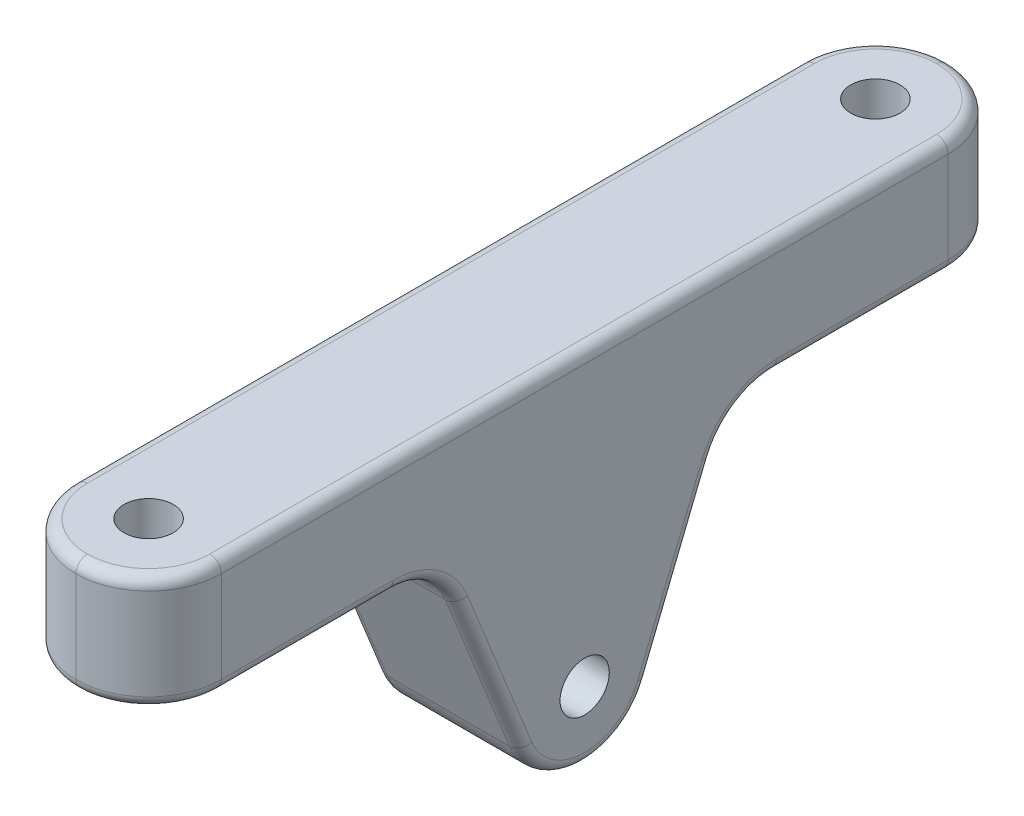
from build123d import *

# Parameters (mm, degrees)
SKETCH1_R           = 2.15
BOSS_EXTRUDE1_DEPTH = 12.7
FILLET1_R           = 6
FILLET2_R           = 6.35
CUT_EXTRUDE1_REACH  = 52.979
SKETCH2_R           = 2.15
CUT_EXTRUDE2_DEPTH  = 4
FILLET3_R           = 1


with BuildPart() as part:
    # Sketch1 → Boss-Extrude1 (new body)
    with BuildSketch(Plane(origin=(0, 0, 0), x_dir=(0, 0, -1), z_dir=(1, 0, 0))):
        Polygon((-38.1, 25.4), (38.1, 25.4), (38.1, 15.4), (12.7, 15.4), (0, -16.003709137), (-12.7, 15.4), (-38.1, 15.4), align=None)
        Circle(SKETCH1_R, mode=Mode.SUBTRACT)
    extrude(amount=BOSS_EXTRUDE1_DEPTH)

    # Fillet1
    fillet1_edges = [part.edges().sort_by_distance(p)[0] for p in [
        (6.35, 15.4, -12.7),
        (6.35, -16.003709137, 0),
        (6.35, 15.4, 12.7),
    ]]
    fillet(fillet1_edges, radius=FILLET1_R)

    # Fillet2
    fillet2_edges = [part.edges().sort_by_distance(p)[0] for p in [
        (0, 20.4, -38.1),
        (12.7, 20.4, -38.1),
        (0, 20.4, 38.1),
        (12.7, 20.4, 38.1),
    ]]
    fillet(fillet2_edges, radius=FILLET2_R - 0.0001)  # a hair under: the kernel refuses the full size

    # Sketch2 → Cut-Extrude1 (cut, up to next)
    with BuildSketch(Plane(origin=(0, 25.4, 0), x_dir=(1, 0, 0), z_dir=(0, 1, 0)), mode=Mode.PRIVATE) as cut_extrude1_sk1:
        with Locations(Location((6.35, -31.75, 0), (0, 0, 270))):
            Circle(SKETCH2_R)
    cut_extrude1_tool1 = extrude(cut_extrude1_sk1.sketch, amount=-CUT_EXTRUDE1_REACH, mode=Mode.PRIVATE) & part.part
    # Sketch2 → Cut-Extrude1 (cut, up to next)
    with BuildSketch(Plane(origin=(0, 25.4, 0), x_dir=(1, 0, 0), z_dir=(0, 1, 0)), mode=Mode.PRIVATE) as cut_extrude1_sk2:
        with Locations(Location((6.35, 31.75, 0), (0, 0, 270))):
            Circle(SKETCH2_R)
    cut_extrude1_tool2 = extrude(cut_extrude1_sk2.sketch, amount=-CUT_EXTRUDE1_REACH, mode=Mode.PRIVATE) & part.part
    add(cut_extrude1_tool1.solids().sort_by_distance((6.35, 25.4, 31.75))[0], mode=Mode.SUBTRACT)
    add(cut_extrude1_tool2.solids().sort_by_distance((6.35, 25.4, -31.75))[0], mode=Mode.SUBTRACT)

    # Sketch3 → Cut-Extrude2 (cut)
    with BuildSketch(Plane.ZY):
        Polygon((0, 4.734272207), (-4.1, 2.367136104), (-4.1, -2.367136104), (0, -4.734272207), (4.1, -2.367136104), (4.1, 2.367136104), align=None)
    extrude(amount=-CUT_EXTRUDE2_DEPTH, mode=Mode.SUBTRACT)

    # Fillet3
    fillet3_edges = [part.edges().sort_by_distance(p)[0] for p in [
        (0, 15.4, -24.247854145),
        (12.7, 15.4, -24.247854145),
        (0, 4.7, -8.372804145),
        (12.7, 4.7, -8.372804145),
        (0, 4.7, 8.372804145),
        (12.7, 4.7, 8.372804145),
        (0, -6, 0),
        (12.7, -6, 0),
        (0, 14.374779952, -13.391273121),
        (12.7, 14.374779952, -13.391273121),
        (0, 14.374779952, 13.391273121),
        (12.7, 14.374779952, 13.391273121),
        (0, 25.4, 0),
        (12.7, 25.4, 0),
        (10.84015735, 25.4, 36.24015735),
        (1.85984265, 25.4, 36.24015735),
        (10.84015735, 25.4, -36.24015735),
        (1.85984265, 25.4, -36.24015735),
        (0, 15.4, 24.247854145),
        (10.84015735, 15.4, -36.24015735),
        (1.85984265, 15.4, -36.24015735),
        (12.7, 15.4, 24.247854145),
        (10.84015735, 15.4, 36.24015735),
        (1.85984265, 15.4, 36.24015735),
    ]]
    fillet(fillet3_edges, radius=FILLET3_R)


solid = part.part
